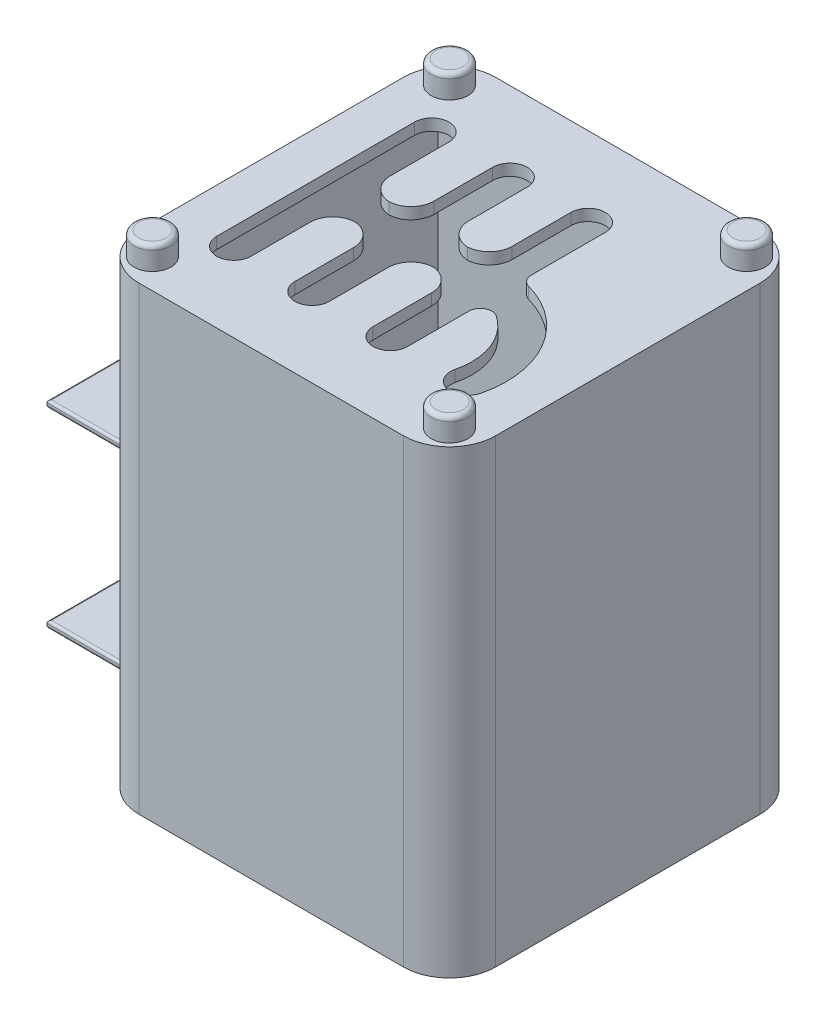
from build123d import *

# Parameters (mm, degrees)
SZKIC1_W                       = 155
SZKIC1_H                       = 155
DODANIE_WYCI_GNI_CIE1_DEPTH    = 200
SZKIC2_W                       = 19
SZKIC2_H                       = 15
SZKIC2_W_2                     = 15
WYTNIJ_WYCI_GNI_CIE1_DEPTH     = 90
ZAOKR_GLENIE1_R                = 20
SZKIC4_R                       = 8
DODANIE_WYCI_GNI_CIE2_DEPTH    = 10
ZAOKR_GLENIE2_R                = 2
SZKIC5_W                       = 135
SZKIC5_H                       = 170
WYTNIJ_WYCI_GNI_CIE2_DEPTH     = 120
SZKIC6_R                       = 10
DODANIE_WYCI_GNI_CIE3_DEPTH    = 80
SZKIC8_W                       = 115
SZKIC8_H                       = 3
DODANIE_WYCI_GNI_CIE4_DEPTH    = 40
SZKIC9_R                       = 4
WYTNIJ_WYCI_GNI_CIE3_DEPTH     = 100
ZAOKR_GLENIE3_R                = 1
OTWORY_USTALAJ_CE_8_0MM1_D     = 8
OTWORY_USTALAJ_CE_8_0MM1_DEPTH = 25
ZAOKR_GLENIE4_R                = 10
ZAOKR_GLENIE5_R                = 5


with BuildPart() as part:
    # Szkic1 → Dodanie-wyciągnięcie1 (new body)
    with BuildSketch(Plane(origin=(0, 0, 0), x_dir=(1, 0, 0), z_dir=(0, 1, 0))):
        Rectangle(SZKIC1_W, SZKIC1_H)
    extrude(amount=DODANIE_WYCI_GNI_CIE1_DEPTH)

    # Szkic2 → Wytnij-wyciągnięcie1 (cut)
    with BuildSketch(Plane(origin=(0, 200, 0), x_dir=(1, 0, 0), z_dir=(0, 1, 0))):
        with BuildLine():
            Line((-58.240160679, 43), (-58.240160679, -43))
            ThreePointArc((-58.240160679, -43), (-50.740160679, -50.5), (-43.240160679, -43))
            Line((-43.240160679, -43), (-43.240160679, -7.5))
            Line((-43.240160679, -7.5), (-43.240160679, 7.5))
            Line((-43.240160679, 7.5), (-43.240160679, 43))
            ThreePointArc((-43.240160679, 43), (-50.740160679, 50.5), (-58.240160679, 43))
        make_face()
        with Locations((-33.740160679, 0)):
            Rectangle(SZKIC2_W, SZKIC2_H)
        with BuildLine():
            Line((-9.240160679, -7.5), (-24.240160679, -7.5))
            Line((-24.240160679, -7.5), (-24.240160679, -43))
            ThreePointArc((-24.240160679, -43), (-16.740160679, -50.5), (-9.240160679, -43))
            Line((-9.240160679, -43), (-9.240160679, -7.5))
        make_face()
        with Locations((-16.740160679, 0)):
            Rectangle(SZKIC2_W_2, SZKIC2_H)
        with BuildLine():
            Line((-24.240160679, 43), (-24.240160679, 7.5))
            Line((-24.240160679, 7.5), (-9.240160679, 7.5))
            Line((-9.240160679, 7.5), (-9.240160679, 43))
            ThreePointArc((-9.240160679, 43), (-16.740160679, 50.5), (-24.240160679, 43))
        make_face()
        Polygon((-9.240160679, 7.5), (-9.240160679, -7.5), (9.759839321, -7.5), (9.759839321, -4.6e-08), (9.759839321, 7.5), align=None)
        with BuildLine():
            Line((17.259839321, -7.5), (9.759839321, -7.5))
            Line((9.759839321, -7.5), (9.759839321, -43))
            ThreePointArc((9.759839321, -43), (17.259839321, -50.5), (24.759839321, -43))
            Line((24.759839321, -43), (24.759839321, -8.554286585))
            ThreePointArc((24.759839321, -8.554286585), (21.046708747, -7.764861006), (17.259839321, -7.5))
        make_face()
        with BuildLine():
            Line((9.759839321, -4.6e-08), (9.759839321, -7.5))
            Line((9.759839321, -7.5), (17.259839321, -7.5))
            ThreePointArc((17.259839321, -7.5), (11.956538478, -5.303300875), (9.759839321, -4.6e-08))
        make_face()
        with BuildLine():
            Line((17.259839321, 7.5), (9.759839321, 7.5))
            Line((9.759839321, 7.5), (9.759839321, -4.6e-08))
            ThreePointArc((9.759839321, -4.6e-08), (11.956538445, 5.303300843), (17.259839321, 7.5))
        make_face()
        with BuildLine():
            Line((9.759839321, 43), (9.759839321, 7.5))
            Line((9.759839321, 7.5), (17.259839321, 7.5))
            ThreePointArc((17.259839321, 7.5), (21.024851006, 7.331726309), (24.759839321, 6.828247104))
            Line((24.759839321, 6.828247104), (24.759839321, 43))
            ThreePointArc((24.759839321, 43), (17.259839321, 50.5), (9.759839321, 43))
        make_face()
        with BuildLine():
            ThreePointArc((17.259839321, 7.5), (11.956538445, 5.303300843), (9.759839321, -4.6e-08))
            ThreePointArc((9.759839321, -4.6e-08), (11.956538478, -5.303300875), (17.259839321, -7.5))
            Line((17.259839321, -7.5), (17.259839321, 7.5))
        make_face()
        with BuildLine():
            Line((17.259839321, 7.5), (17.259839321, -7.5))
            ThreePointArc((17.259839321, -7.5), (21.046708747, -7.764861006), (24.759839321, -8.554286585))
            Line((24.759839321, -8.554286585), (24.759839321, 6.828247104))
            ThreePointArc((24.759839321, 6.828247104), (21.024851006, 7.331726309), (17.259839321, 7.5))
        make_face()
        with BuildLine():
            Line((24.759839321, 6.828247104), (24.759839321, -8.554286585))
            ThreePointArc((24.759839321, -8.554286585), (40.799428369, -21.067870737), (43.675059249, -41.207109854))
            ThreePointArc((43.675059249, -41.207109854), (49.164719818, -50.282550715), (58.240160679, -44.792890146))
            ThreePointArc((58.240160679, -44.792890146), (52.668465989, -11.738702912), (24.759839321, 6.828247104))
        make_face()
    extrude(amount=-WYTNIJ_WYCI_GNI_CIE1_DEPTH, mode=Mode.SUBTRACT)

    # Zaokrąglenie1
    zaokr_glenie1_edges = [part.edges().sort_by_distance(p)[0] for p in [
        (77.5, 100, 77.5),
        (-77.5, 100, 77.5),
        (-77.5, 100, -77.5),
        (77.5, 100, -77.5),
    ]]
    fillet(zaokr_glenie1_edges, radius=ZAOKR_GLENIE1_R)

    # Szkic4 → Dodanie-wyciągnięcie2 (add)
    with BuildSketch(Plane(origin=(0, 200, 0), x_dir=(1, 0, 0), z_dir=(0, 1, 0))):
        with Locations(Location((-64.571067812, -64.571067812, 0), (0, 0, 90))):
            Circle(SZKIC4_R)
        with Locations(Location((-64.571067812, 64.571067812, 0), (0, 0, 90))):
            Circle(SZKIC4_R)
        with Locations(Location((64.571067812, 64.571067812, 0), (0, 0, 90))):
            Circle(SZKIC4_R)
        with Locations(Location((64.571067812, -64.571067812, 0), (0, 0, 90))):
            Circle(SZKIC4_R)
    extrude(amount=DODANIE_WYCI_GNI_CIE2_DEPTH)

    # Zaokrąglenie2
    zaokr_glenie2_edges = [part.edges().sort_by_distance(p)[0] for p in [
        (-64.571067812, 210, 72.571067812),
        (-64.571067812, 210, -56.571067812),
        (64.571067812, 210, -56.571067812),
        (64.571067812, 210, 72.571067812),
    ]]
    fillet(zaokr_glenie2_edges, radius=ZAOKR_GLENIE2_R)

    # Szkic5 → Wytnij-wyciągnięcie2 (cut)
    with BuildSketch(Plane.XY.offset(57.5)):
        with Locations((0, 110)):
            Rectangle(SZKIC5_W, SZKIC5_H)
    extrude(amount=-WYTNIJ_WYCI_GNI_CIE2_DEPTH, mode=Mode.SUBTRACT)

    # Szkic6 → Dodanie-wyciągnięcie3 (add)
    with BuildSketch(Plane(origin=(0, 25, 0), x_dir=(1, 0, 0), z_dir=(0, 1, 0))):
        with Locations(Location((-16.740160679, 0, 0), (0, 0, 90))):
            Circle(SZKIC6_R)
    extrude(amount=DODANIE_WYCI_GNI_CIE3_DEPTH)

    # Szkic7 → Wycięcie-obrót1 (revolve, cut)
    with BuildSketch(Plane(origin=(0, 105, 0), x_dir=(1, 0, 0), z_dir=(0, 1, 0))):
        with BuildLine():
            Line((-16.740160679, 8), (-16.740160679, -8))
            ThreePointArc((-16.740160679, -8), (-8.740160679, 0), (-16.740160679, 8))
        make_face()
    revolve(axis=Axis((-16.740160679, 105, -8), (0, 0, 1)), mode=Mode.SUBTRACT)

    # Szkic8 → Dodanie-wyciągnięcie4 (add)
    with BuildSketch(Plane.ZY.offset(77.5)):
        with Locations((0, 114.5)):
            Rectangle(SZKIC8_W, SZKIC8_H)
        with Locations((0, 31.5)):
            Rectangle(SZKIC8_W, SZKIC8_H)
    extrude(amount=DODANIE_WYCI_GNI_CIE4_DEPTH)

    # Szkic9 → Wytnij-wyciągnięcie3 (cut)
    with BuildSketch(Plane(origin=(0, 116, 0), x_dir=(1, 0, 0), z_dir=(0, 1, 0))):
        with Locations(Location((-97.5, 37.5, 0), (0, 0, 270))):
            Circle(SZKIC9_R)
        with Locations(Location((-97.5, -37.5, 0), (0, 0, 270))):
            Circle(SZKIC9_R)
    extrude(amount=-WYTNIJ_WYCI_GNI_CIE3_DEPTH, mode=Mode.SUBTRACT)

    # Zaokrąglenie3
    zaokr_glenie3_edges = [part.edges().sort_by_distance(p)[0] for p in [
        (-97.5, 116, -57.5),
        (-97.5, 113, -57.5),
        (-97.5, 113, 57.5),
        (-97.5, 116, 57.5),
        (-117.5, 113, 0),
        (-117.5, 116, 0),
        (-97.5, 30, 57.5),
        (-97.5, 33, 57.5),
        (-97.5, 33, -57.5),
        (-97.5, 30, -57.5),
        (-117.5, 33, 0),
        (-117.5, 30, 0),
    ]]
    fillet(zaokr_glenie3_edges, radius=ZAOKR_GLENIE3_R)

    # Otwory ustalające Ø8.0mm1
    with Locations(Plane(origin=(0, 0, 0), x_dir=(-1, 0, 0), z_dir=(0, -1, 0))):
        with Locations((55, 55), (55, -55), (-55, -55), (-55, 55)):
            Hole(OTWORY_USTALAJ_CE_8_0MM1_D / 2, depth=OTWORY_USTALAJ_CE_8_0MM1_DEPTH)

    # Zaokrąglenie4
    # the kernel refuses this fillet: 10 mm, written as the material it takes off along each edge
    with BuildSketch(Plane(origin=(-9.240160679, 225, 7.5), x_dir=(0, 0, 1), z_dir=(0, -1, 0)), Plane(origin=(9.759839321, 225, 7.5), x_dir=(-1, 0, 0), z_dir=(0, -1, 0)), Plane(origin=(-24.240160679, 225, 7.5), x_dir=(-1, 0, 0), z_dir=(0, -1, 0)), Plane(origin=(-43.240160679, 225, 7.5), x_dir=(0, 0, 1), z_dir=(0, -1, 0))) as zaokr_glenie4_piece_1:
        with BuildLine():
            CenterArc((ZAOKR_GLENIE4_R, -ZAOKR_GLENIE4_R), ZAOKR_GLENIE4_R, 90, 90)
            Line((0, -ZAOKR_GLENIE4_R), (0, 0))
            Line((0, 0), (ZAOKR_GLENIE4_R, 0))
        make_face()
    extrude(amount=55, mode=Mode.SUBTRACT)
    with BuildSketch(Plane(origin=(9.759839321, 225, -7.5), x_dir=(-1, 0, 0), z_dir=(0, -1, 0)), Plane(origin=(-9.240160679, 225, -7.5), x_dir=(0, 0, -1), z_dir=(0, -1, 0)), Plane(origin=(-24.240160679, 225, -7.5), x_dir=(-1, 0, 0), z_dir=(0, -1, 0)), Plane(origin=(-43.240160679, 225, -7.5), x_dir=(0, 0, -1), z_dir=(0, -1, 0))) as zaokr_glenie4_piece_2:
        with BuildLine():
            CenterArc((ZAOKR_GLENIE4_R, ZAOKR_GLENIE4_R), ZAOKR_GLENIE4_R, 180, 90)
            Line((0, ZAOKR_GLENIE4_R), (0, 0))
            Line((0, 0), (ZAOKR_GLENIE4_R, 0))
        make_face()
    extrude(amount=55, mode=Mode.SUBTRACT)

    # Zaokrąglenie5
    zaokr_glenie5_edges = [part.edges().sort_by_distance(p)[0] for p in [
        (24.759839321, 197.5, 8.554286585),
        (24.759839321, 197.5, -6.828247104),
    ]]
    fillet(zaokr_glenie5_edges, radius=ZAOKR_GLENIE5_R)


solid = part.part
